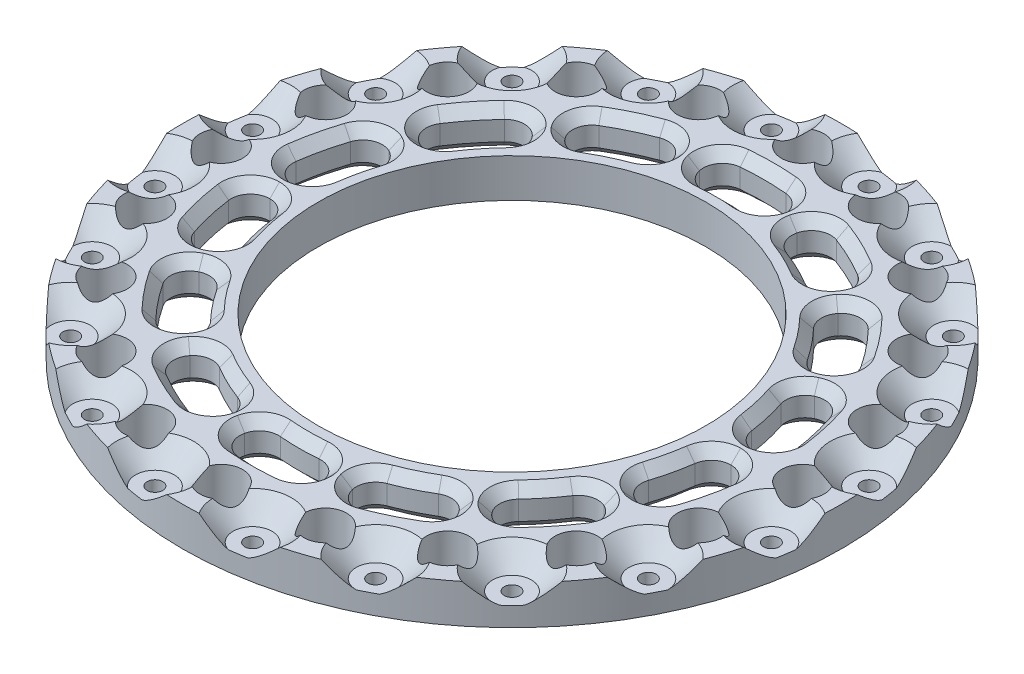
from build123d import *

# Parameters (mm, degrees)
SKETCH1_R                    = 85
SKETCH1_R_2                  = 5.5
SKETCH1_R_3                  = 50
BOSS_EXTRUDE1_DEPTH          = 10
SKETCH4_R                    = 65
SKETCH4_R_2                  = 55
CUT_EXTRUDE2_DEPTH           = 10
BOSS_EXTRUDE3_DEPTH          = 10
FILLET3_R                    = 5
CIRPATTERN2_COUNT            = 14
FILLET3_OF_CIRPATTERN2_R     = 5
CHAMFER1_SIZE                = 2.5
CHAMFER2_SIZE                = 2.5
CUT_EXTRUDE3_DEPTH           = 10
SKETCH8_R                    = 5
CUT_EXTRUDE4_DEPTH           = 5
CHAMFER3_SIZE                = 5
CIRPATTERN3_COUNT            = 20
CHAMFER3_OF_CIRPATTERN3_SIZE = 5


# Some blends are built 0.0001 mm under size
with BuildPart() as part:
    # Sketch1 → Boss-Extrude1 (new body)
    with BuildSketch(Plane(origin=(0, 0, 0), x_dir=(1, 0, 0), z_dir=(0, 1, 0))):
        with Locations(Location((0, 0, 0), (0, 0, 270))):
            Circle(SKETCH1_R)
        with Locations(Location((75, 0, 0), (0, 0, 270))):
            Circle(SKETCH1_R_2, mode=Mode.SUBTRACT)
        with Locations(Location((71.329238722, -23.176274578, 0), (0, 0, 270))):
            Circle(SKETCH1_R_2, mode=Mode.SUBTRACT)
        with Locations(Location((60.676274578, -44.083893922, 0), (0, 0, 270))):
            Circle(SKETCH1_R_2, mode=Mode.SUBTRACT)
        with Locations(Location((44.083893922, -60.676274578, 0), (0, 0, 270))):
            Circle(SKETCH1_R_2, mode=Mode.SUBTRACT)
        with Locations(Location((23.176274578, -71.329238722, 0), (0, 0, 270))):
            Circle(SKETCH1_R_2, mode=Mode.SUBTRACT)
        with Locations(Location((0, -75, 0), (0, 0, 270))):
            Circle(SKETCH1_R_2, mode=Mode.SUBTRACT)
        with Locations(Location((-23.176274578, -71.329238722, 0), (0, 0, 270))):
            Circle(SKETCH1_R_2, mode=Mode.SUBTRACT)
        with Locations(Location((-44.083893922, -60.676274578, 0), (0, 0, 270))):
            Circle(SKETCH1_R_2, mode=Mode.SUBTRACT)
        with Locations(Location((-60.676274578, -44.083893922, 0), (0, 0, 270))):
            Circle(SKETCH1_R_2, mode=Mode.SUBTRACT)
        with Locations(Location((-71.329238722, -23.176274578, 0), (0, 0, 270))):
            Circle(SKETCH1_R_2, mode=Mode.SUBTRACT)
        with Locations(Location((-75, 0, 0), (0, 0, 270))):
            Circle(SKETCH1_R_2, mode=Mode.SUBTRACT)
        with Locations(Location((-71.329238722, 23.176274578, 0), (0, 0, 270))):
            Circle(SKETCH1_R_2, mode=Mode.SUBTRACT)
        with Locations(Location((-60.676274578, 44.083893922, 0), (0, 0, 270))):
            Circle(SKETCH1_R_2, mode=Mode.SUBTRACT)
        with Locations(Location((-44.083893922, 60.676274578, 0), (0, 0, 270))):
            Circle(SKETCH1_R_2, mode=Mode.SUBTRACT)
        with Locations(Location((-23.176274578, 71.329238722, 0), (0, 0, 270))):
            Circle(SKETCH1_R_2, mode=Mode.SUBTRACT)
        with Locations(Location((0, 75, 0), (0, 0, 270))):
            Circle(SKETCH1_R_2, mode=Mode.SUBTRACT)
        with Locations(Location((23.176274578, 71.329238722, 0), (0, 0, 270))):
            Circle(SKETCH1_R_2, mode=Mode.SUBTRACT)
        with Locations(Location((44.083893922, 60.676274578, 0), (0, 0, 270))):
            Circle(SKETCH1_R_2, mode=Mode.SUBTRACT)
        with Locations(Location((60.676274578, 44.083893922, 0), (0, 0, 270))):
            Circle(SKETCH1_R_2, mode=Mode.SUBTRACT)
        with Locations(Location((71.329238722, 23.176274578, 0), (0, 0, 270))):
            Circle(SKETCH1_R_2, mode=Mode.SUBTRACT)
        with Locations(Location((0, 0, 0), (0, 0, 270))):
            Circle(SKETCH1_R_3, mode=Mode.SUBTRACT)
    extrude(amount=BOSS_EXTRUDE1_DEPTH)

    # Sketch4 → Cut-Extrude2 (cut)
    with BuildSketch(Plane(origin=(0, 10, 0), x_dir=(1, 0, 0), z_dir=(0, 1, 0))):
        with Locations(Location((0, 0, 0), (0, 0, 270))):
            Circle(SKETCH4_R)
        with Locations(Location((0, 0, 0), (0, 0, 270))):
            Circle(SKETCH4_R_2, mode=Mode.SUBTRACT)
    extrude(amount=-CUT_EXTRUDE2_DEPTH, mode=Mode.SUBTRACT)


with BuildPart() as cut_extrude2_piece_1:
    # of the separate pieces the step leaves, piece 1, a body of its own (cut_extrude2_pieces)
    add(part.part.solids().sort_by_distance((0, 0, 85))[0])



with BuildPart() as cut_extrude2_piece_2:
    # of the separate pieces the step leaves, piece 2, a body of its own (cut_extrude2_pieces)
    add(part.part.solids().sort_by_distance((0, 0, 55))[0])


with BuildPart() as cut_extrude2_piece_1_1:
    add(cut_extrude2_piece_1.part)

    add(cut_extrude2_piece_2.part)  # Boss-Extrude3 merges Cut-Extrude2 piece 2
    # Sketch5 → Boss-Extrude3 (add)
    with BuildSketch(Plane(origin=(0, 10, 0), x_dir=(1, 0, 0), z_dir=(0, 1, 0))):
        with BuildLine():
            Line((-55, 0), (-60, 0))
            Line((-60, 0), (-60, -3))
            Line((-60, -3), (-54.918120871, -3))
            ThreePointArc((-54.918120871, -3), (-54.979526407, -1.500558579), (-55, 0))
        make_face()
        with BuildLine():
            Line((-60, 0), (-65, 0))
            ThreePointArc((-65, 0), (-64.982680773, -1.500399781), (-64.930732323, -3))
            Line((-64.930732323, -3), (-60, -3))
            Line((-60, -3), (-60, 0))
        make_face()
        with BuildLine():
            ThreePointArc((-64.930732323, 3), (-64.982680773, 1.500399781), (-65, 0))
            Line((-65, 0), (-60, 0))
            Line((-60, 0), (-60, 3))
            Line((-60, 3), (-64.930732323, 3))
        make_face()
        with BuildLine():
            Line((-60, 3), (-60, 0))
            Line((-60, 0), (-55, 0))
            ThreePointArc((-55, 0), (-54.979526407, 1.500558579), (-54.918120871, 3))
            Line((-54.918120871, 3), (-60, 3))
        make_face()
    boss_extrude3 = extrude(amount=-BOSS_EXTRUDE3_DEPTH)

    # Fillet3
    fillet3_edges = [cut_extrude2_piece_1_1.edges().sort_by_distance(p)[0] for p in [
        (-54.918120871, 5, -3),
        (-64.930732323, 5, -3),
        (-54.918120871, 5, 3),
        (-64.930732323, 5, 3),
    ]]
    fillet(fillet3_edges, radius=FILLET3_R - 0.0001)  # a hair under: the kernel refuses the full size

    # CirPattern2: Boss-Extrude3 ×14 about axis
    cirpattern2_axis = Axis((0, 0, 0), (0, 1, 0))
    for i in range(1, CIRPATTERN2_COUNT):
        add(boss_extrude3.rotate(cirpattern2_axis, i * 360 / CIRPATTERN2_COUNT))

    # Fillet3 of CirPattern2
    fillet3_of_cirpattern2_edges = [cut_extrude2_piece_1_1.edges().sort_by_distance(p)[0] for p in [
        (-50.781168406, 5, 21.125173025),
        (-59.80221961, 5, 25.46948232),
        (-48.177865971, 5, 26.530986233),
        (-57.198917176, 5, 30.875295528),
        (-36.586382748, 5, 41.066246449),
        (-42.829143878, 5, 48.894421304),
        (-31.895393853, 5, 44.80718526),
        (-38.138154983, 5, 52.635360115),
        (-15.145215284, 5, 52.87364612),
        (-17.373230936, 5, 62.635220498),
        (-9.295647811, 5, 54.208771724),
        (-11.523663462, 5, 63.970346102),
        (9.295647811, 5, 54.208771724),
        (11.523663462, 5, 63.970346102),
        (15.145215284, 5, 52.87364612),
        (17.373230936, 5, 62.635220498),
        (31.895393853, 5, 44.80718526),
        (38.138154983, 5, 52.635360115),
        (36.586382748, 5, 41.066246449),
        (42.829143878, 5, 48.894421304),
        (48.177865971, 5, 26.530986233),
        (57.198917176, 5, 30.875295528),
        (50.781168406, 5, 21.125173025),
        (59.80221961, 5, 25.46948232),
        (54.918120871, 5, 3),
        (64.930732323, 5, 3),
        (54.918120871, 5, -3),
        (64.930732323, 5, -3),
        (50.781168406, 5, -21.125173025),
        (59.80221961, 5, -25.46948232),
        (48.177865971, 5, -26.530986233),
        (57.198917176, 5, -30.875295528),
        (36.586382748, 5, -41.066246449),
        (42.829143878, 5, -48.894421304),
        (31.895393853, 5, -44.80718526),
        (38.138154983, 5, -52.635360115),
        (15.145215284, 5, -52.87364612),
        (17.373230936, 5, -62.635220498),
        (9.295647811, 5, -54.208771724),
        (11.523663462, 5, -63.970346102),
        (-9.295647811, 5, -54.208771724),
        (-11.523663462, 5, -63.970346102),
        (-15.145215284, 5, -52.87364612),
        (-17.373230936, 5, -62.635220498),
        (-31.895393853, 5, -44.80718526),
        (-38.138154983, 5, -52.635360115),
        (-36.586382748, 5, -41.066246449),
        (-42.829143878, 5, -48.894421304),
        (-48.177865971, 5, -26.530986233),
        (-57.198917176, 5, -30.875295528),
        (-50.781168406, 5, -21.125173025),
        (-59.80221961, 5, -25.46948232),
    ]]
    fillet(fillet3_of_cirpattern2_edges, radius=FILLET3_OF_CIRPATTERN2_R - 0.0001)  # a hair under: the kernel refuses the full size

    # Chamfer1
    chamfer1_edges = [cut_extrude2_piece_1_1.edges().sort_by_distance(p)[0] for p in [
        (-23.863605651, 10, -49.553287735),
        (-28.202443043, 10, -58.562976414),
        (-8.36972835, 10, -55.707101249),
        (-9.479086488, 10, -62.69066487),
        (-16.629540709, 10, -53.821852979),
        (-18.66009826, 10, -60.595158845),
        (-43.000731536, 10, -34.291939102),
        (-50.81904636, 10, -40.526837121),
        (-31.711270062, 10, -46.558874915),
        (-35.740821903, 10, -52.369515867),
        (-53.62103517, 10, 12.238651368),
        (-38.335125283, 10, -41.276526644),
        (-43.103421696, 10, -46.498038459),
        (-63.370314292, 10, 14.463860707),
        (-56.172847684, 10, -4.236114412),
        (-63.228174193, 10, -4.708559298),
        (-53.62103517, 10, -12.238651368),
        (-63.370314292, 10, -14.463860707),
        (-48.772005824, 10, -28.189092396),
        (-54.923649208, 10, -31.675941977),
        (-56.172847684, 10, 4.236114412),
        (-52.447968145, 10, -20.555877984),
        (-59.009583837, 10, -23.191411296),
        (-63.228174193, 10, 4.708559298),
        (-43.000731536, 10, 34.291939102),
        (-50.81904636, 10, 40.526837121),
        (-52.447968145, 10, 20.555877984),
        (-59.009583837, 10, 23.191411296),
        (-48.772005824, 10, 28.189092396),
        (-54.923649208, 10, 31.675941977),
        (-23.863605651, 10, 49.553287735),
        (-28.202443043, 10, 58.562976414),
        (-38.335125283, 10, 41.276526644),
        (-43.103421696, 10, 46.498038459),
        (-31.711270062, 10, 46.558874915),
        (-35.740821903, 10, 52.369515867),
        (0, 10, 55),
        (0, 10, 65),
        (-16.629540709, 10, 53.821852979),
        (-18.66009826, 10, 60.595158845),
        (-8.36972835, 10, 55.707101249),
        (-9.479086488, 10, 62.69066487),
        (23.863605651, 10, 49.553287735),
        (28.202443043, 10, 58.562976414),
        (8.36972835, 10, 55.707101249),
        (9.479086488, 10, 62.69066487),
        (16.629540709, 10, 53.821852979),
        (18.66009826, 10, 60.595158845),
        (43.000731536, 10, 34.291939102),
        (50.81904636, 10, 40.526837121),
        (31.711270062, 10, 46.558874915),
        (35.740821903, 10, 52.369515867),
        (38.335125283, 10, 41.276526644),
        (43.103421696, 10, 46.498038459),
        (53.62103517, 10, 12.238651368),
        (63.370314292, 10, 14.463860707),
        (48.772005824, 10, 28.189092396),
        (54.923649208, 10, 31.675941977),
        (52.447968145, 10, 20.555877984),
        (59.009583837, 10, 23.191411296),
        (53.62103517, 10, -12.238651368),
        (63.370314292, 10, -14.463860707),
        (56.172847684, 10, 4.236114412),
        (63.228174193, 10, 4.708559298),
        (56.172847684, 10, -4.236114412),
        (63.228174193, 10, -4.708559298),
        (43.000731536, 10, -34.291939102),
        (50.81904636, 10, -40.526837121),
        (52.447968145, 10, -20.555877984),
        (59.009583837, 10, -23.191411296),
        (48.772005824, 10, -28.189092396),
        (54.923649208, 10, -31.675941977),
        (23.863605651, 10, -49.553287735),
        (28.202443043, 10, -58.562976414),
        (38.335125283, 10, -41.276526644),
        (43.103421696, 10, -46.498038459),
        (31.711270062, 10, -46.558874915),
        (35.740821903, 10, -52.369515867),
        (0, 10, -55),
        (0, 10, -65),
        (16.629540709, 10, -53.821852979),
        (18.66009826, 10, -60.595158845),
        (8.36972835, 10, -55.707101249),
        (9.479086488, 10, -62.69066487),
    ]]
    chamfer(chamfer1_edges, length=CHAMFER1_SIZE)

    # Chamfer2
    chamfer2_edges = [cut_extrude2_piece_1_1.edges().sort_by_distance(p)[0] for p in [
        (-23.863605651, 0, -49.553287735),
        (-28.202443043, 0, -58.562976414),
        (-8.36972835, 0, -55.707101249),
        (-9.479086488, 0, -62.69066487),
        (-16.629540709, 0, -53.821852979),
        (-18.66009826, 0, -60.595158845),
        (-43.000731536, 0, -34.291939102),
        (-50.81904636, 0, -40.526837121),
        (-31.711270062, 0, -46.558874915),
        (-35.740821903, 0, -52.369515867),
        (-53.62103517, 0, 12.238651368),
        (-38.335125283, 0, -41.276526644),
        (-43.103421696, 0, -46.498038459),
        (-63.370314292, 0, 14.463860707),
        (-56.172847684, 0, -4.236114412),
        (-53.62103517, 0, -12.238651368),
        (-63.370314292, 0, -14.463860707),
        (-48.772005824, 0, -28.189092396),
        (-63.228174193, 0, -4.708559298),
        (-54.923649208, 0, -31.675941977),
        (-52.447968145, 0, -20.555877984),
        (-56.172847684, 0, 4.236114412),
        (-59.009583837, 0, -23.191411296),
        (-63.228174193, 0, 4.708559298),
        (-43.000731536, 0, 34.291939102),
        (-50.81904636, 0, 40.526837121),
        (-52.447968145, 0, 20.555877984),
        (-59.009583837, 0, 23.191411296),
        (-48.772005824, 0, 28.189092396),
        (-54.923649208, 0, 31.675941977),
        (-23.863605651, 0, 49.553287735),
        (-28.202443043, 0, 58.562976414),
        (-38.335125283, 0, 41.276526644),
        (-43.103421696, 0, 46.498038459),
        (-31.711270062, 0, 46.558874915),
        (-35.740821903, 0, 52.369515867),
        (0, 0, 55),
        (0, 0, 65),
        (-16.629540709, 0, 53.821852979),
        (-18.66009826, 0, 60.595158845),
        (-8.36972835, 0, 55.707101249),
        (-9.479086488, 0, 62.69066487),
        (23.863605651, 0, 49.553287735),
        (28.202443043, 0, 58.562976414),
        (8.36972835, 0, 55.707101249),
        (9.479086488, 0, 62.69066487),
        (16.629540709, 0, 53.821852979),
        (18.66009826, 0, 60.595158845),
        (43.000731536, 0, 34.291939102),
        (50.81904636, 0, 40.526837121),
        (31.711270062, 0, 46.558874915),
        (35.740821903, 0, 52.369515867),
        (38.335125283, 0, 41.276526644),
        (43.103421696, 0, 46.498038459),
        (53.62103517, 0, 12.238651368),
        (63.370314292, 0, 14.463860707),
        (48.772005824, 0, 28.189092396),
        (54.923649208, 0, 31.675941977),
        (52.447968145, 0, 20.555877984),
        (59.009583837, 0, 23.191411296),
        (53.62103517, 0, -12.238651368),
        (63.370314292, 0, -14.463860707),
        (56.172847684, 0, 4.236114412),
        (63.228174193, 0, 4.708559298),
        (56.172847684, 0, -4.236114412),
        (63.228174193, 0, -4.708559298),
        (43.000731536, 0, -34.291939102),
        (50.81904636, 0, -40.526837121),
        (52.447968145, 0, -20.555877984),
        (59.009583837, 0, -23.191411296),
        (48.772005824, 0, -28.189092396),
        (54.923649208, 0, -31.675941977),
        (23.863605651, 0, -49.553287735),
        (28.202443043, 0, -58.562976414),
        (38.335125283, 0, -41.276526644),
        (43.103421696, 0, -46.498038459),
        (31.711270062, 0, -46.558874915),
        (35.740821903, 0, -52.369515867),
        (0, 0, -55),
        (0, 0, -65),
        (16.629540709, 0, -53.821852979),
        (18.66009826, 0, -60.595158845),
        (8.36972835, 0, -55.707101249),
        (9.479086488, 0, -62.69066487),
    ]]
    chamfer(chamfer2_edges, length=CHAMFER2_SIZE)

    # Sketch6 → Cut-Extrude3 (cut)
    with BuildSketch(Plane(origin=(0, 10, 0), x_dir=(1, 0, 0), z_dir=(0, 1, 0))):
        with BuildLine():
            ThreePointArc((-79.797217366, 10.613863605), (-78.323313496, 10.98227348), (-77.533534737, 12.280105506))
            Line((-77.533534737, 12.280105506), (-79.508911418, 12.592974436))
            ThreePointArc((-79.508911418, 12.592974436), (-79.659210936, 11.604314415), (-79.797217366, 10.613863605))
        make_face()
        with BuildLine():
            Line((-79.508911418, 12.592974436), (-77.533534737, 12.280105506))
            ThreePointArc((-77.533534737, 12.280105506), (-77.51507675, 12.436056244), (-77.508911418, 12.592974436))
            ThreePointArc((-77.508911418, 12.592974436), (-77.98006099, 13.882399257), (-79.171527788, 14.564312125))
            ThreePointArc((-79.171527788, 14.564312125), (-79.346342006, 13.579691096), (-79.508911418, 12.592974436))
        make_face()
        with BuildLine():
            ThreePointArc((-79.797217366, 10.613863605), (-79.659210936, 11.604314415), (-79.508911418, 12.592974436))
            Line((-79.508911418, 12.592974436), (-81.484288099, 12.905843366))
            ThreePointArc((-81.484288099, 12.905843366), (-81.119612373, 11.407376514), (-79.797217366, 10.613863605))
        make_face()
        with BuildLine():
            Line((-81.484288099, 12.905843366), (-79.508911418, 12.592974436))
            ThreePointArc((-79.508911418, 12.592974436), (-79.346342006, 13.579691096), (-79.171527788, 14.564312125))
            ThreePointArc((-79.171527788, 14.564312125), (-80.674409151, 14.218279033), (-81.484288099, 12.905843366))
        make_face()
    cut_extrude3 = extrude(amount=-CUT_EXTRUDE3_DEPTH, mode=Mode.SUBTRACT)

    # Sketch8 → Cut-Extrude4 (cut)
    with BuildSketch(Plane(origin=(0, 10, 0), x_dir=(1, 0, 0), z_dir=(0, 1, 0))):
        with Locations((-79.508911418, 12.592974436)):
            Circle(SKETCH8_R)
    cut_extrude4 = extrude(amount=-CUT_EXTRUDE4_DEPTH, mode=Mode.SUBTRACT)

    # Chamfer3
    # the kernel refuses this chamfer: 5 mm, written as the material it takes off along each edge
    with BuildSketch(Plane(origin=(-79.508911418, 10, -12.592974436), x_dir=(-0.9871920139949474, 0, -0.15953660239769316), z_dir=(-0.15953660239769316, 0, 0.9871920139949474))) as chamfer3_piece_1_section:
        Polygon((5, CHAMFER3_SIZE), (5 + CHAMFER3_SIZE, 0), (5, 0), align=None)
    chamfer3_piece_1 = revolve(axis=Axis((-79.508911418, 10, -12.592974436), (0, -1, 0)), revolution_arc=359.64, mode=Mode.PRIVATE)
    chamfer3_piece_1 = split(chamfer3_piece_1, bisect_by=Plane(origin=(-72.089429749, 5, -11.417843984), z_dir=(0, 1, 0)), keep=Keep.TOP, mode=Mode.PRIVATE)
    add(chamfer3_piece_1, mode=Mode.SUBTRACT)

    # CirPattern3: Cut-Extrude3, Cut-Extrude4 ×20 about axis
    cirpattern3_axis = Axis((0, 0, 0), (0, 1, 0))
    add([cut_extrude3.rotate(cirpattern3_axis, i * 360 / CIRPATTERN3_COUNT) for i in range(1, CIRPATTERN3_COUNT)], mode=Mode.SUBTRACT)
    add([cut_extrude4.rotate(cirpattern3_axis, i * 360 / CIRPATTERN3_COUNT) for i in range(1, CIRPATTERN3_COUNT)], mode=Mode.SUBTRACT)

    # Chamfer3 of CirPattern3
    # the kernel refuses this chamfer: 5 mm, written as the material it takes off along each edge
    with BuildSketch(Plane(origin=(-79.508911418, 10, 12.592974436), x_dir=(-0.988174919110282, 0, 0.15333078373695097), z_dir=(0.15333078373695097, 0, 0.988174919110282))) as chamfer3_of_cirpattern3_piece_1_section:
        Polygon((5, CHAMFER3_OF_CIRPATTERN3_SIZE), (5 + CHAMFER3_OF_CIRPATTERN3_SIZE, 0), (5, 0), align=None)
    chamfer3_of_cirpattern3_piece_1 = revolve(axis=Axis((-79.508911418, 10, 12.592974436), (0, -1, 0)), revolution_arc=359.64, mode=Mode.PRIVATE)
    chamfer3_of_cirpattern3_piece_1 = split(chamfer3_of_cirpattern3_piece_1, bisect_by=Plane(origin=(-72.089429748, 5, 11.417843984), z_dir=(0, 1, 0)), keep=Keep.TOP, mode=Mode.PRIVATE)
    add(chamfer3_of_cirpattern3_piece_1, mode=Mode.SUBTRACT)
    with BuildSketch(Plane(origin=(-71.726025197, 10, 36.546235229), x_dir=(-0.8924283781237292, 0, 0.45118908444182254), z_dir=(0.45118908444182254, 0, 0.8924283781237292))) as chamfer3_of_cirpattern3_piece_2_section:
        Polygon((5, CHAMFER3_OF_CIRPATTERN3_SIZE), (5 + CHAMFER3_OF_CIRPATTERN3_SIZE, 0), (5, 0), align=None)
    chamfer3_of_cirpattern3_piece_2 = revolve(axis=Axis((-71.726025197, 10, 36.546235229), (0, -1, 0)), revolution_arc=359.64, mode=Mode.PRIVATE)
    chamfer3_of_cirpattern3_piece_2 = split(chamfer3_of_cirpattern3_piece_2, bisect_by=Plane(origin=(-65.032814088, 5, 33.13587383), z_dir=(0, 1, 0)), keep=Keep.TOP, mode=Mode.PRIVATE)
    add(chamfer3_of_cirpattern3_piece_2, mode=Mode.SUBTRACT)
    with BuildSketch(Plane(origin=(-56.922095886, 10, 56.922095886), x_dir=(-0.7093247295722782, 0, 0.7048818539423571), z_dir=(0.7048818539423571, 0, 0.7093247295722782))) as chamfer3_of_cirpattern3_piece_3_section:
        Polygon((5, CHAMFER3_OF_CIRPATTERN3_SIZE), (5 + CHAMFER3_OF_CIRPATTERN3_SIZE, 0), (5, 0), align=None)
    chamfer3_of_cirpattern3_piece_3 = revolve(axis=Axis((-56.922095886, 10, 56.922095886), (0, -1, 0)), revolution_arc=359.64, mode=Mode.PRIVATE)
    chamfer3_of_cirpattern3_piece_3 = split(chamfer3_of_cirpattern3_piece_3, bisect_by=Plane(origin=(-51.610333474, 5, 51.610333474), z_dir=(0, 1, 0)), keep=Keep.TOP, mode=Mode.PRIVATE)
    add(chamfer3_of_cirpattern3_piece_3, mode=Mode.SUBTRACT)
    with BuildSketch(Plane(origin=(-36.546235229, 10, 71.726025197), x_dir=(-0.45678743433429997, 0, 0.8895758763783377), z_dir=(0.8895758763783377, 0, 0.45678743433429997))) as chamfer3_of_cirpattern3_piece_4_section:
        Polygon((5, CHAMFER3_OF_CIRPATTERN3_SIZE), (5 + CHAMFER3_OF_CIRPATTERN3_SIZE, 0), (5, 0), align=None)
    chamfer3_of_cirpattern3_piece_4 = revolve(axis=Axis((-36.546235229, 10, 71.726025197), (0, -1, 0)), revolution_arc=359.64, mode=Mode.PRIVATE)
    chamfer3_of_cirpattern3_piece_4 = split(chamfer3_of_cirpattern3_piece_4, bisect_by=Plane(origin=(-33.13587383, 5, 65.032814088), z_dir=(0, 1, 0)), keep=Keep.TOP, mode=Mode.PRIVATE)
    add(chamfer3_of_cirpattern3_piece_4, mode=Mode.SUBTRACT)
    with BuildSketch(Plane(origin=(-12.592974436, 10, 79.508911418), x_dir=(-0.15953660239849657, 0, 0.9871920139948175), z_dir=(0.9871920139948175, 0, 0.15953660239849657))) as chamfer3_of_cirpattern3_piece_5_section:
        Polygon((5, CHAMFER3_OF_CIRPATTERN3_SIZE), (5 + CHAMFER3_OF_CIRPATTERN3_SIZE, 0), (5, 0), align=None)
    chamfer3_of_cirpattern3_piece_5 = revolve(axis=Axis((-12.592974436, 10, 79.508911418), (0, -1, 0)), revolution_arc=359.64, mode=Mode.PRIVATE)
    chamfer3_of_cirpattern3_piece_5 = split(chamfer3_of_cirpattern3_piece_5, bisect_by=Plane(origin=(-11.417843984, 5, 72.089429748), z_dir=(0, 1, 0)), keep=Keep.TOP, mode=Mode.PRIVATE)
    add(chamfer3_of_cirpattern3_piece_5, mode=Mode.SUBTRACT)
    with BuildSketch(Plane(origin=(12.592974436, 10, 79.508911418), x_dir=(0.15333078373695314, 0, 0.9881749191102817), z_dir=(0.9881749191102817, 0, -0.15333078373695314))) as chamfer3_of_cirpattern3_piece_6_section:
        Polygon((5, CHAMFER3_OF_CIRPATTERN3_SIZE), (5 + CHAMFER3_OF_CIRPATTERN3_SIZE, 0), (5, 0), align=None)
    chamfer3_of_cirpattern3_piece_6 = revolve(axis=Axis((12.592974436, 10, 79.508911418), (0, -1, 0)), revolution_arc=359.64, mode=Mode.PRIVATE)
    chamfer3_of_cirpattern3_piece_6 = split(chamfer3_of_cirpattern3_piece_6, bisect_by=Plane(origin=(11.417843984, 5, 72.089429748), z_dir=(0, 1, 0)), keep=Keep.TOP, mode=Mode.PRIVATE)
    add(chamfer3_of_cirpattern3_piece_6, mode=Mode.SUBTRACT)
    with BuildSketch(Plane(origin=(36.546235229, 10, 71.726025197), x_dir=(0.45118908444181915, 0, 0.892428378123731), z_dir=(0.892428378123731, 0, -0.45118908444181915))) as chamfer3_of_cirpattern3_piece_7_section:
        Polygon((5, CHAMFER3_OF_CIRPATTERN3_SIZE), (5 + CHAMFER3_OF_CIRPATTERN3_SIZE, 0), (5, 0), align=None)
    chamfer3_of_cirpattern3_piece_7 = revolve(axis=Axis((36.546235229, 10, 71.726025197), (0, -1, 0)), revolution_arc=359.64, mode=Mode.PRIVATE)
    chamfer3_of_cirpattern3_piece_7 = split(chamfer3_of_cirpattern3_piece_7, bisect_by=Plane(origin=(33.13587383, 5, 65.032814088), z_dir=(0, 1, 0)), keep=Keep.TOP, mode=Mode.PRIVATE)
    add(chamfer3_of_cirpattern3_piece_7, mode=Mode.SUBTRACT)
    with BuildSketch(Plane(origin=(56.922095886, 10, 56.922095886), x_dir=(0.7048818539423557, 0, 0.7093247295722797), z_dir=(0.7093247295722797, 0, -0.7048818539423557))) as chamfer3_of_cirpattern3_piece_8_section:
        Polygon((5, CHAMFER3_OF_CIRPATTERN3_SIZE), (5 + CHAMFER3_OF_CIRPATTERN3_SIZE, 0), (5, 0), align=None)
    chamfer3_of_cirpattern3_piece_8 = revolve(axis=Axis((56.922095886, 10, 56.922095886), (0, -1, 0)), revolution_arc=359.64, mode=Mode.PRIVATE)
    chamfer3_of_cirpattern3_piece_8 = split(chamfer3_of_cirpattern3_piece_8, bisect_by=Plane(origin=(51.610333475, 5, 51.610333475), z_dir=(0, 1, 0)), keep=Keep.TOP, mode=Mode.PRIVATE)
    add(chamfer3_of_cirpattern3_piece_8, mode=Mode.SUBTRACT)
    with BuildSketch(Plane(origin=(71.726025197, 10, 36.546235229), x_dir=(0.8895758763783388, 0, 0.4567874343342977), z_dir=(0.4567874343342977, 0, -0.8895758763783388))) as chamfer3_of_cirpattern3_piece_9_section:
        Polygon((5, CHAMFER3_OF_CIRPATTERN3_SIZE), (5 + CHAMFER3_OF_CIRPATTERN3_SIZE, 0), (5, 0), align=None)
    chamfer3_of_cirpattern3_piece_9 = revolve(axis=Axis((71.726025197, 10, 36.546235229), (0, -1, 0)), revolution_arc=359.64, mode=Mode.PRIVATE)
    chamfer3_of_cirpattern3_piece_9 = split(chamfer3_of_cirpattern3_piece_9, bisect_by=Plane(origin=(65.032814088, 5, 33.13587383), z_dir=(0, 1, 0)), keep=Keep.TOP, mode=Mode.PRIVATE)
    add(chamfer3_of_cirpattern3_piece_9, mode=Mode.SUBTRACT)
    with BuildSketch(Plane(origin=(79.508911418, 10, 12.592974436), x_dir=(0.9871920139948177, 0, 0.15953660239849474), z_dir=(0.15953660239849474, 0, -0.9871920139948177))) as chamfer3_of_cirpattern3_piece_10_section:
        Polygon((5, CHAMFER3_OF_CIRPATTERN3_SIZE), (5 + CHAMFER3_OF_CIRPATTERN3_SIZE, 0), (5, 0), align=None)
    chamfer3_of_cirpattern3_piece_10 = revolve(axis=Axis((79.508911418, 10, 12.592974436), (0, -1, 0)), revolution_arc=359.64, mode=Mode.PRIVATE)
    chamfer3_of_cirpattern3_piece_10 = split(chamfer3_of_cirpattern3_piece_10, bisect_by=Plane(origin=(72.089429748, 5, 11.417843984), z_dir=(0, 1, 0)), keep=Keep.TOP, mode=Mode.PRIVATE)
    add(chamfer3_of_cirpattern3_piece_10, mode=Mode.SUBTRACT)
    with BuildSketch(Plane(origin=(79.508911418, 10, -12.592974436), x_dir=(0.9881749191102819, 0, -0.15333078373695166), z_dir=(-0.15333078373695166, 0, -0.9881749191102819))) as chamfer3_of_cirpattern3_piece_11_section:
        Polygon((5, CHAMFER3_OF_CIRPATTERN3_SIZE), (5 + CHAMFER3_OF_CIRPATTERN3_SIZE, 0), (5, 0), align=None)
    chamfer3_of_cirpattern3_piece_11 = revolve(axis=Axis((79.508911418, 10, -12.592974436), (0, -1, 0)), revolution_arc=359.64, mode=Mode.PRIVATE)
    chamfer3_of_cirpattern3_piece_11 = split(chamfer3_of_cirpattern3_piece_11, bisect_by=Plane(origin=(72.089429748, 5, -11.417843984), z_dir=(0, 1, 0)), keep=Keep.TOP, mode=Mode.PRIVATE)
    add(chamfer3_of_cirpattern3_piece_11, mode=Mode.SUBTRACT)
    with BuildSketch(Plane(origin=(71.726025197, 10, -36.546235229), x_dir=(0.8924283781237299, 0, -0.45118908444182143), z_dir=(-0.45118908444182143, 0, -0.8924283781237299))) as chamfer3_of_cirpattern3_piece_12_section:
        Polygon((5, CHAMFER3_OF_CIRPATTERN3_SIZE), (5 + CHAMFER3_OF_CIRPATTERN3_SIZE, 0), (5, 0), align=None)
    chamfer3_of_cirpattern3_piece_12 = revolve(axis=Axis((71.726025197, 10, -36.546235229), (0, -1, 0)), revolution_arc=359.64, mode=Mode.PRIVATE)
    chamfer3_of_cirpattern3_piece_12 = split(chamfer3_of_cirpattern3_piece_12, bisect_by=Plane(origin=(65.032814088, 5, -33.13587383), z_dir=(0, 1, 0)), keep=Keep.TOP, mode=Mode.PRIVATE)
    add(chamfer3_of_cirpattern3_piece_12, mode=Mode.SUBTRACT)
    with BuildSketch(Plane(origin=(56.922095886, 10, -56.922095886), x_dir=(0.7093247295722803, 0, -0.7048818539423549), z_dir=(-0.7048818539423549, 0, -0.7093247295722803))) as chamfer3_of_cirpattern3_piece_13_section:
        Polygon((5, CHAMFER3_OF_CIRPATTERN3_SIZE), (5 + CHAMFER3_OF_CIRPATTERN3_SIZE, 0), (5, 0), align=None)
    chamfer3_of_cirpattern3_piece_13 = revolve(axis=Axis((56.922095886, 10, -56.922095886), (0, -1, 0)), revolution_arc=359.64, mode=Mode.PRIVATE)
    chamfer3_of_cirpattern3_piece_13 = split(chamfer3_of_cirpattern3_piece_13, bisect_by=Plane(origin=(51.610333474, 5, -51.610333474), z_dir=(0, 1, 0)), keep=Keep.TOP, mode=Mode.PRIVATE)
    add(chamfer3_of_cirpattern3_piece_13, mode=Mode.SUBTRACT)
    with BuildSketch(Plane(origin=(36.546235229, 10, -71.726025197), x_dir=(0.4567874343343034, 0, -0.8895758763783359), z_dir=(-0.8895758763783359, 0, -0.4567874343343034))) as chamfer3_of_cirpattern3_piece_14_section:
        Polygon((5, CHAMFER3_OF_CIRPATTERN3_SIZE), (5 + CHAMFER3_OF_CIRPATTERN3_SIZE, 0), (5, 0), align=None)
    chamfer3_of_cirpattern3_piece_14 = revolve(axis=Axis((36.546235229, 10, -71.726025197), (0, -1, 0)), revolution_arc=359.64, mode=Mode.PRIVATE)
    chamfer3_of_cirpattern3_piece_14 = split(chamfer3_of_cirpattern3_piece_14, bisect_by=Plane(origin=(33.13587383, 5, -65.032814088), z_dir=(0, 1, 0)), keep=Keep.TOP, mode=Mode.PRIVATE)
    add(chamfer3_of_cirpattern3_piece_14, mode=Mode.SUBTRACT)
    with BuildSketch(Plane(origin=(12.592974436, 10, -79.508911418), x_dir=(0.15953660239849476, 0, -0.9871920139948179), z_dir=(-0.9871920139948179, 0, -0.15953660239849476))) as chamfer3_of_cirpattern3_piece_15_section:
        Polygon((5, CHAMFER3_OF_CIRPATTERN3_SIZE), (5 + CHAMFER3_OF_CIRPATTERN3_SIZE, 0), (5, 0), align=None)
    chamfer3_of_cirpattern3_piece_15 = revolve(axis=Axis((12.592974436, 10, -79.508911418), (0, -1, 0)), revolution_arc=359.64, mode=Mode.PRIVATE)
    chamfer3_of_cirpattern3_piece_15 = split(chamfer3_of_cirpattern3_piece_15, bisect_by=Plane(origin=(11.417843984, 5, -72.089429748), z_dir=(0, 1, 0)), keep=Keep.TOP, mode=Mode.PRIVATE)
    add(chamfer3_of_cirpattern3_piece_15, mode=Mode.SUBTRACT)
    with BuildSketch(Plane(origin=(-12.592974436, 10, -79.508911418), x_dir=(-0.15333078373694575, 0, -0.9881749191102828), z_dir=(-0.9881749191102828, 0, 0.15333078373694575))) as chamfer3_of_cirpattern3_piece_16_section:
        Polygon((5, CHAMFER3_OF_CIRPATTERN3_SIZE), (5 + CHAMFER3_OF_CIRPATTERN3_SIZE, 0), (5, 0), align=None)
    chamfer3_of_cirpattern3_piece_16 = revolve(axis=Axis((-12.592974436, 10, -79.508911418), (0, -1, 0)), revolution_arc=359.64, mode=Mode.PRIVATE)
    chamfer3_of_cirpattern3_piece_16 = split(chamfer3_of_cirpattern3_piece_16, bisect_by=Plane(origin=(-11.417843984, 5, -72.089429748), z_dir=(0, 1, 0)), keep=Keep.TOP, mode=Mode.PRIVATE)
    add(chamfer3_of_cirpattern3_piece_16, mode=Mode.SUBTRACT)
    with BuildSketch(Plane(origin=(-36.546235229, 10, -71.726025197), x_dir=(-0.45118908444182027, 0, -0.8924283781237303), z_dir=(-0.8924283781237303, 0, 0.45118908444182027))) as chamfer3_of_cirpattern3_piece_17_section:
        Polygon((5, CHAMFER3_OF_CIRPATTERN3_SIZE), (5 + CHAMFER3_OF_CIRPATTERN3_SIZE, 0), (5, 0), align=None)
    chamfer3_of_cirpattern3_piece_17 = revolve(axis=Axis((-36.546235229, 10, -71.726025197), (0, -1, 0)), revolution_arc=359.64, mode=Mode.PRIVATE)
    chamfer3_of_cirpattern3_piece_17 = split(chamfer3_of_cirpattern3_piece_17, bisect_by=Plane(origin=(-33.13587383, 5, -65.032814088), z_dir=(0, 1, 0)), keep=Keep.TOP, mode=Mode.PRIVATE)
    add(chamfer3_of_cirpattern3_piece_17, mode=Mode.SUBTRACT)
    with BuildSketch(Plane(origin=(-56.922095886, 10, -56.922095886), x_dir=(-0.7048818539423549, 0, -0.7093247295722803), z_dir=(-0.7093247295722803, 0, 0.7048818539423549))) as chamfer3_of_cirpattern3_piece_18_section:
        Polygon((5, CHAMFER3_OF_CIRPATTERN3_SIZE), (5 + CHAMFER3_OF_CIRPATTERN3_SIZE, 0), (5, 0), align=None)
    chamfer3_of_cirpattern3_piece_18 = revolve(axis=Axis((-56.922095886, 10, -56.922095886), (0, -1, 0)), revolution_arc=359.64, mode=Mode.PRIVATE)
    chamfer3_of_cirpattern3_piece_18 = split(chamfer3_of_cirpattern3_piece_18, bisect_by=Plane(origin=(-51.610333474, 5, -51.610333474), z_dir=(0, 1, 0)), keep=Keep.TOP, mode=Mode.PRIVATE)
    add(chamfer3_of_cirpattern3_piece_18, mode=Mode.SUBTRACT)
    with BuildSketch(Plane(origin=(-71.726025197, 10, -36.546235229), x_dir=(-0.8895758763783377, 0, -0.45678743433429997), z_dir=(-0.45678743433429997, 0, 0.8895758763783377))) as chamfer3_of_cirpattern3_piece_19_section:
        Polygon((5, CHAMFER3_OF_CIRPATTERN3_SIZE), (5 + CHAMFER3_OF_CIRPATTERN3_SIZE, 0), (5, 0), align=None)
    chamfer3_of_cirpattern3_piece_19 = revolve(axis=Axis((-71.726025197, 10, -36.546235229), (0, -1, 0)), revolution_arc=359.64, mode=Mode.PRIVATE)
    chamfer3_of_cirpattern3_piece_19 = split(chamfer3_of_cirpattern3_piece_19, bisect_by=Plane(origin=(-65.032814087, 5, -33.13587383), z_dir=(0, 1, 0)), keep=Keep.TOP, mode=Mode.PRIVATE)
    add(chamfer3_of_cirpattern3_piece_19, mode=Mode.SUBTRACT)


solid = cut_extrude2_piece_1_1.part
